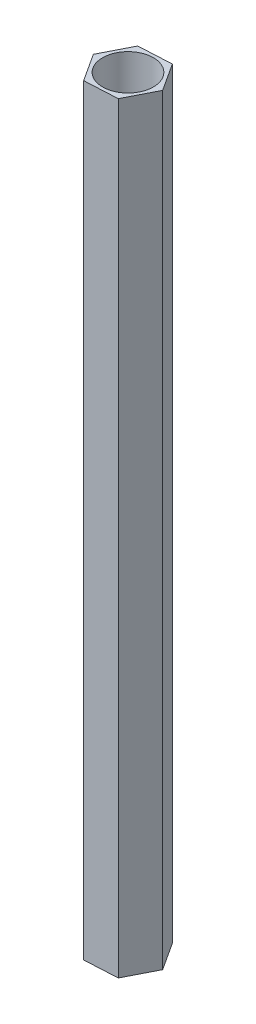
from build123d import *

# Parameters (mm, degrees)
SKETCH1_R           = 2
BOSS_EXTRUDE1_DEPTH = 60


with BuildPart() as part:
    # Sketch1 → Boss-Extrude1 (new body)
    with BuildSketch(Plane(origin=(0, 0, 0), x_dir=(1, 0, 0), z_dir=(0, 1, 0))):
        Polygon((1.413277895, -2.180056328), (2.594623109, 0.133906396), (1.181345214, 2.313962724), (-1.413277895, 2.180056328), (-2.594623109, -0.133906396), (-1.181345214, -2.313962724), align=None)
        Circle(SKETCH1_R, mode=Mode.SUBTRACT)
    extrude(amount=BOSS_EXTRUDE1_DEPTH)


solid = part.part
